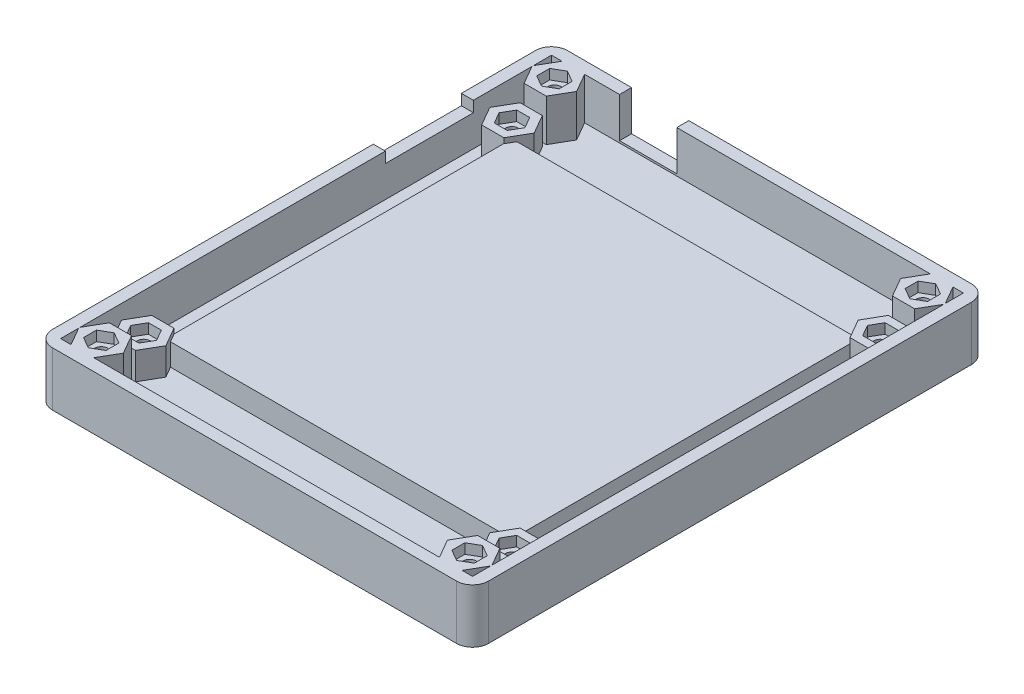
from build123d import *

# Parameters (mm, degrees)
P_IDAT_VYSUNUT_M25_DEPTH      = 3
P_IDAT_VYSUNUT_M26_DEPTH      = 10.5
P_IDAT_VYSUNUT_M26_DEPTH_BACK = 3
SKICA1_21_W                   = 108.885125168
SKICA1_21_H                   = 128.6
SKICA1_21_W_2                 = 102.885125168
SKICA1_21_H_2                 = 122.6
P_IDAT_VYSUNUT_M28_DEPTH      = 6.8
SKICA1_24_R                   = 1.6
P_IDAT_VYSUNUT_M29_DEPTH      = 4.3
LINPOLE3_COUNT                = 2
LINPOLE3_PITCH                = 92
LINPOLE3_COUNT_DIR2           = 2
LINPOLE3_PITCH_DIR2           = 92
P_IDAT_VYSUNUT_M30_DEPTH      = 10.5
SKICA1_26_R                   = 1.6
P_IDAT_VYSUNUT_M31_DEPTH      = 8
LINPOLE4_COUNT                = 2
LINPOLE4_PITCH                = 92
LINPOLE4_COUNT_DIR2           = 2
LINPOLE4_PITCH_DIR2           = 113.2
SKICA8_W                      = 86.538297386
SKICA8_H                      = 86.538297386
P_IDAT_VYSUNUT_M32_DEPTH      = 5.5
ZAOBLIT4_R                    = 4
SKICA9_W                      = 22
SKICA9_H                      = 2.7
ODEBRAT_VYSUNUT_M1_DEPTH      = 10
SKICA10_W                     = 14.3
SKICA10_H                     = 10
ODEBRAT_VYSUNUT_M2_DEPTH      = 5


with BuildPart() as part:
    # Skica1 → Přidat vysunutím25 (new body)
    with BuildSketch(Plane(origin=(0, 0, 0), x_dir=(1, 0, 0), z_dir=(0, 1, 0))):
        Polygon((51.442562584, 61.3), (-43.170983681, 61.3), (-43.228718708, 61.4), (-48.771281292, 61.4), (-48.829016319, 61.3), (-51.442562584, 61.3), (-51.442562584, 56.773205081), (-51.542562584, 56.6), (-51.442562584, 56.426794919), (-51.442562584, 46.173205081), (-51.542562584, 46), (-51.442562584, 45.826794919), (-51.442562584, -61.3), (51.442562584, -61.3), align=None)
    extrude(amount=-P_IDAT_VYSUNUT_M25_DEPTH)

    # Skica1<21> → Přidat vysunutím26 (add, two sides: drawn at the far end of the back side and taken through both)
    with BuildSketch(Plane(origin=(0, 0, 0), x_dir=(1, 0, 0), z_dir=(0, 1, 0)).offset(-P_IDAT_VYSUNUT_M26_DEPTH_BACK)):
        Rectangle(SKICA1_21_W, SKICA1_21_H)
        Rectangle(SKICA1_21_W_2, SKICA1_21_H_2, mode=Mode.SUBTRACT)
    extrude(amount=P_IDAT_VYSUNUT_M26_DEPTH + P_IDAT_VYSUNUT_M26_DEPTH_BACK)

    # Skica1<23> → Přidat vysunutím28 (add)
    with BuildSketch(Plane(origin=(0, 0, 0), x_dir=(1, 0, 0), z_dir=(0, 1, 0))):
        Polygon((-48.771281292, 41.2), (-43.228718708, 41.2), (-40.457437416, 46), (-43.228718708, 50.8), (-48.771281292, 50.8), (-51.542562584, 46), align=None)
        Polygon((-44.383419246, 43.2), (-47.616580754, 43.2), (-49.233161507, 46), (-47.616580754, 48.8), (-44.383419246, 48.8), (-42.766838493, 46), align=None, mode=Mode.SUBTRACT)
    p_idat_vysunut_m28 = extrude(amount=P_IDAT_VYSUNUT_M28_DEPTH)

    # Skica1<24> → Přidat vysunutím29 (add)
    with BuildSketch(Plane(origin=(0, 0, 0), x_dir=(1, 0, 0), z_dir=(0, 1, 0))):
        Polygon((-49.233161507, 46), (-47.616580754, 43.2), (-44.383419246, 43.2), (-42.766838493, 46), (-44.383419246, 48.8), (-47.616580754, 48.8), align=None)
        with Locations((-46, 46)):
            Circle(SKICA1_24_R, mode=Mode.SUBTRACT)
    p_idat_vysunut_m29 = extrude(amount=P_IDAT_VYSUNUT_M29_DEPTH)

    # LinPole3: Přidat vysunutím28, P_idat vysunut_m29 2 × 2
    with Locations(*[(i * LINPOLE3_PITCH, 0, j * LINPOLE3_PITCH_DIR2) for i in range(LINPOLE3_COUNT) for j in range(LINPOLE3_COUNT_DIR2) if (i, j) != (0, 0)]):
        add(p_idat_vysunut_m28)
        add(p_idat_vysunut_m29)

    # Skica1<25> → Přidat vysunutím30 (add)
    with BuildSketch(Plane(origin=(0, 0, 0), x_dir=(1, 0, 0), z_dir=(0, 1, 0))):
        Polygon((-51.542562584, 56.6), (-48.771281292, 51.8), (-43.228718708, 51.8), (-40.457437416, 56.6), (-43.228718708, 61.4), (-48.771281292, 61.4), align=None)
        Polygon((-43.2, 54.983419246), (-46, 53.366838493), (-48.8, 54.983419246), (-48.8, 58.216580754), (-46, 59.833161507), (-43.2, 58.216580754), align=None, mode=Mode.SUBTRACT)
    p_idat_vysunut_m30 = extrude(amount=P_IDAT_VYSUNUT_M30_DEPTH)

    # Skica1<26> → Přidat vysunutím31 (add)
    with BuildSketch(Plane(origin=(0, 0, 0), x_dir=(1, 0, 0), z_dir=(0, 1, 0))):
        Polygon((-48.8, 54.983419246), (-46, 53.366838493), (-43.2, 54.983419246), (-43.2, 58.216580754), (-46, 59.833161507), (-48.8, 58.216580754), align=None)
        with Locations((-46, 56.6)):
            Circle(SKICA1_26_R, mode=Mode.SUBTRACT)
    p_idat_vysunut_m31 = extrude(amount=P_IDAT_VYSUNUT_M31_DEPTH)

    # LinPole4: Přidat vysunutím30, P_idat vysunut_m31 2 × 2
    with Locations(*[(i * LINPOLE4_PITCH, 0, j * LINPOLE4_PITCH_DIR2) for i in range(LINPOLE4_COUNT) for j in range(LINPOLE4_COUNT_DIR2) if (i, j) != (0, 0)]):
        add(p_idat_vysunut_m30)
        add(p_idat_vysunut_m31)

    # Skica8 → Přidat vysunutím32 (add)
    with BuildSketch(Plane(origin=(0, 0, 0), x_dir=(1, 0, 0), z_dir=(0, 1, 0))):
        Rectangle(SKICA8_W, SKICA8_H)
    extrude(amount=P_IDAT_VYSUNUT_M32_DEPTH)

    # Zaoblit4
    zaoblit4_edges = [part.edges().sort_by_distance(p)[0] for p in [
        (-54.442562584, 3.75, 64.3),
        (54.442562584, 3.75, 64.3),
        (54.442562584, 3.75, -64.3),
        (-54.442562584, 3.75, -64.3),
    ]]
    fillet(zaoblit4_edges, radius=ZAOBLIT4_R)

    # Skica9 → Odebrat vysunutím1 (cut)
    with BuildSketch(Plane.ZY.offset(54.442562584)):
        with Locations((-30.8, 9.15)):
            Rectangle(SKICA9_W, SKICA9_H)
    extrude(amount=-ODEBRAT_VYSUNUT_M1_DEPTH, mode=Mode.SUBTRACT)

    # Skica10 → Odebrat vysunutím2 (cut)
    with BuildSketch(Plane(origin=(0, 0, -64.3), x_dir=(-1, 0, 0), z_dir=(0, 0, -1))):
        with Locations((27.292562584, 5.5)):
            Rectangle(SKICA10_W, SKICA10_H)
    extrude(amount=-ODEBRAT_VYSUNUT_M2_DEPTH, mode=Mode.SUBTRACT)


solid = part.part
